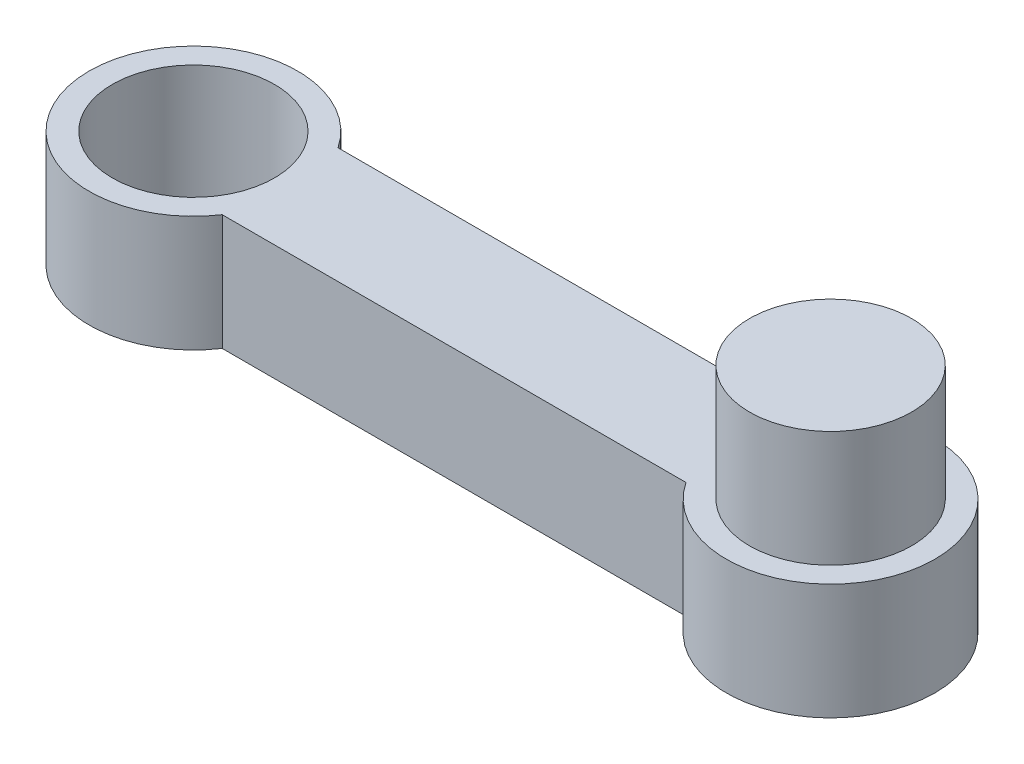
from build123d import *

# Parameters (mm, degrees)
BOSS_EXTRUDE1_DEPTH = 100
SKETCH2_R           = 70
CUT_EXTRUDE1_DEPTH  = 100
SKETCH3_R           = 70
BOSS_EXTRUDE2_DEPTH = 100


with BuildPart() as part:
    # Sketch1 → Boss-Extrude1 (new body)
    with BuildSketch(Plane(origin=(0, 0, 0), x_dir=(1, 0, 0), z_dir=(0, 1, 0))):
        with BuildLine():
            Line((-242.625717576, 275.741810419), (-242.625717576, 275.992438563))
            Line((-242.625717576, 275.992438563), (157.374282424, 275.992438563))
            Line((157.374282424, 275.992438563), (157.374282424, 275.741810419))
            ThreePointArc((157.374282424, 275.741810419), (322.374282424, 225.992438563), (157.374282424, 176.243066708))
            Line((157.374282424, 176.243066708), (157.374282424, 175.992438563))
            Line((157.374282424, 175.992438563), (-242.625717576, 175.992438563))
            Line((-242.625717576, 175.992438563), (-242.625717576, 176.243066708))
            ThreePointArc((-242.625717576, 176.243066708), (-407.625717576, 225.992438563), (-242.625717576, 275.741810419))
        make_face()
    extrude(amount=BOSS_EXTRUDE1_DEPTH)

    # Sketch2 → Cut-Extrude1 (cut)
    with BuildSketch(Plane(origin=(0, 100, 0), x_dir=(1, 0, 0), z_dir=(0, 1, 0))):
        with Locations((-317.625717576, 225.992438563)):
            Circle(SKETCH2_R)
    extrude(amount=-CUT_EXTRUDE1_DEPTH, mode=Mode.SUBTRACT)

    # Sketch3 → Boss-Extrude2 (add)
    with BuildSketch(Plane(origin=(0, 100, 0), x_dir=(1, 0, 0), z_dir=(0, 1, 0))):
        with Locations((232.374282424, 225.992438563)):
            Circle(SKETCH3_R)
    extrude(amount=BOSS_EXTRUDE2_DEPTH)


solid = part.part
